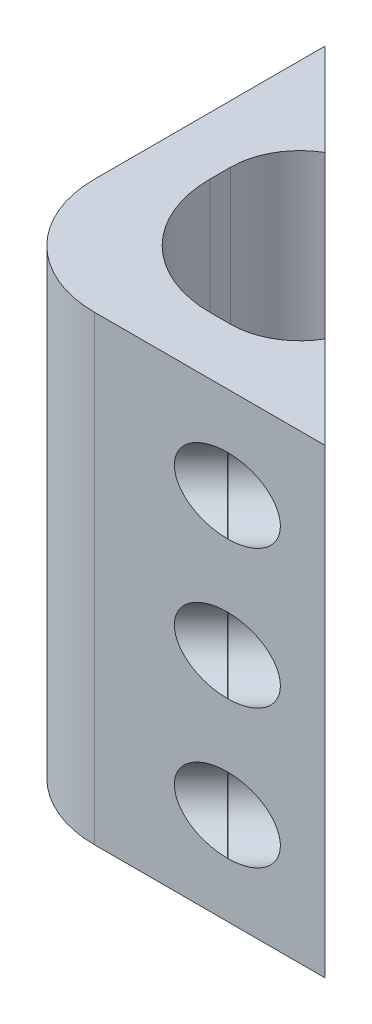
from build123d import *

# Parameters (mm, degrees)
SKETCH1_W                                    = 30
SKETCH1_H                                    = 30
SKETCH1_R                                    = 10
BOSS_EXTRUDE1_DEPTH                          = 40
CUT_EXTRUDE1_DEPTH                           = 59.309518948
CUT_EXTRUDE2_DEPTH                           = 59.309518948
BOSS_EXTRUDE2_DEPTH                          = 40
FILLET1_R                                    = 6
M3_CLEARANCE_HOLE1_D                         = 3.2
M3_CLEARANCE_HOLE1_CSINK_D                   = 3.25
M3_CLEARANCE_HOLE1_CSINK_ANGLE               = 90
CBORE_FOR_M3_HEX_SOCKET_HEAD_CAP_SCR_2_COUNT = 2
CBORE_FOR_M3_HEX_SOCKET_HEAD_CAP_SCR_2_PITCH = 12
CBORE_FOR_M3_HEX_SOCKET_HEAD_CAP_SCR_3_COUNT = 2
CBORE_FOR_M3_HEX_SOCKET_HEAD_CAP_SCR_3_PITCH = 24
CBORE_FOR_M3_HEX_SOCKET_HEAD_CAP_SCR_4_COUNT = 2
CBORE_FOR_M3_HEX_SOCKET_HEAD_CAP_SCR_4_PITCH = 30.426406871
CBORE_FOR_M3_HEX_SOCKET_HEAD_CAP_SCR_5_COUNT = 2
CBORE_FOR_M3_HEX_SOCKET_HEAD_CAP_SCR_5_PITCH = 32.707281072
CBORE_FOR_M3_HEX_SOCKET_HEAD_CAP_SCR_6_COUNT = 2
CBORE_FOR_M3_HEX_SOCKET_HEAD_CAP_SCR_6_PITCH = 38.752628751
SKETCH10_R                                   = 3.25
CUT_EXTRUDE3_DEPTH                           = 47.55178469
FILLET2_R                                    = 10


with BuildPart() as part:
    # Sketch1 → Boss-Extrude1 (new body)
    with BuildSketch(Plane(origin=(0, 0, 0), x_dir=(1, 0, 0), z_dir=(0, 1, 0))):
        with Locations((15, 15)):
            Rectangle(SKETCH1_W, SKETCH1_H)
        with Locations(Location((15, 15, 0), (0, 0, 270))):
            Circle(SKETCH1_R, mode=Mode.SUBTRACT)
    extrude(amount=BOSS_EXTRUDE1_DEPTH)

    # Sketch2 → Cut-Extrude1 (cut, through all)
    with BuildSketch(Plane(origin=(0, 40, 0), x_dir=(1, 0, 0), z_dir=(0, 1, 0))):
        with BuildLine():
            Line((5, 15), (5, 30))
            Line((5, 30), (30, 30))
            Line((30, 30), (30, 5))
            Line((30, 5), (15, 5))
            ThreePointArc((15, 5), (7.928932188, 7.928932188), (5, 15))
        make_face()
    extrude(amount=-CUT_EXTRUDE1_DEPTH, mode=Mode.SUBTRACT)

    # Sketch3 → Cut-Extrude2 (cut, through all)
    with BuildSketch(Plane(origin=(0, 40, 0), x_dir=(1, 0, 0), z_dir=(0, 1, 0))):
        Polygon((0, 30), (5, 25), (5, 30), align=None)
        Polygon((30, 0), (25, 5), (30, 5), align=None)
    extrude(amount=-CUT_EXTRUDE2_DEPTH, mode=Mode.SUBTRACT)

    # Sketch7 → Boss-Extrude2 (add)
    with BuildSketch(Plane(origin=(0, 40, 0), x_dir=(1, 0, 0), z_dir=(0, 1, 0))):
        Polygon((5, 25), (8, 22), (5, 22), align=None)
        Polygon((25, 5), (22, 8), (22, 5), align=None)
    extrude(amount=-BOSS_EXTRUDE2_DEPTH)

    # Fillet1
    # the kernel refuses this fillet: 6 mm, written as the material it adds along each edge
    with BuildSketch(Plane(origin=(5, 40, -22), x_dir=(1, 0, 0), z_dir=(0, -1, 0))) as fillet1_piece_1_section:
        with BuildLine():
            CenterArc((6, 5.196152423), FILLET1_R, 180, 60)
            Line((0, 5.196152423), (-0.12, 5.196152423))
            Line((-0.12, 5.196152423), (-0.12, 0))
            Line((-0.12, 0), (0, -0.12))
            ThreePointArc((0, -0.12), (1.5, -0.12), (2.94, -0.103923048))
            Line((2.94, -0.103923048), (3, 0))
        make_face()
    fillet1_piece_1 = extrude(amount=40, mode=Mode.PRIVATE)
    fillet1_piece_1 = split(fillet1_piece_1, bisect_by=Plane(origin=(7.537314478, 20, -22.462685522), z_dir=(-0.7071067811865479, 0, 0.7071067811865474)), keep=Keep.TOP, mode=Mode.PRIVATE)
    add(fillet1_piece_1)
    with BuildSketch(Plane(origin=(22, 40, -5), x_dir=(-1, 0, 0), z_dir=(0, -1, 0))) as fillet1_piece_2_section:
        with BuildLine():
            CenterArc((5.196152423, 6), FILLET1_R, 210, 60)
            Line((0, 3), (-0.103923048, 2.94))
            ThreePointArc((-0.103923048, 2.94), (-0.12, 1.5), (-0.12, 0))
            Line((-0.12, 0), (0, -0.12))
            Line((0, -0.12), (5.196152423, -0.12))
            Line((5.196152423, -0.12), (5.196152423, 0))
        make_face()
    fillet1_piece_2 = extrude(amount=40, mode=Mode.PRIVATE)
    fillet1_piece_2 = split(fillet1_piece_2, bisect_by=Plane(origin=(22.462685522, 20, -7.537314478), z_dir=(-0.7071067811865436, 0, 0.7071067811865516)), keep=Keep.TOP, mode=Mode.PRIVATE)
    add(fillet1_piece_2)

    # M3 Clearance Hole1 (through all)
    with Locations(Plane(origin=(15, 0, -15), x_dir=(-0.7071067811865475, 0, -0.7071067811865476), z_dir=(0.7071067811865476, 0, -0.7071067811865475))):
        with Locations((-15.213203436, 32), (15.213203436, 32), (15.213203436, 20), (15.213203436, 8), (-15.213203436, 8), (-15.213203436, 20)):
            CounterSinkHole(M3_CLEARANCE_HOLE1_D / 2, M3_CLEARANCE_HOLE1_CSINK_D / 2, counter_sink_angle=M3_CLEARANCE_HOLE1_CSINK_ANGLE)

    # Sketch9 → CBORE for M3 Hex Socket Head Cap Screw1 (revolve, cut)
    with BuildSketch(Plane(origin=(21.514718626, 32, 0), x_dir=(0.7071067811865515, 0, 0.7071067811865436), z_dir=(0, 1, 0))):
        Polygon((0, 0), (0, 27.213203436), (1.7, 27.213203436), (1.7, 3.4), (3.25, 3.4), (3.25, 0.025), (3.275, 0), align=None)
    cbore_for_m3_hex_socket_head_cap_screw1 = revolve(axis=Axis((17.024590565, 32, 4.490128061), (0.7071067811865436, 0, -0.7071067811865515)), mode=Mode.SUBTRACT)

    # CBORE for M3 Hex Socket Head Cap Scr 2: CBORE for M3 Hex Socket Head Cap Screw1 ×2
    with Locations(*[(0, -i * CBORE_FOR_M3_HEX_SOCKET_HEAD_CAP_SCR_2_PITCH, 0) for i in range(1, CBORE_FOR_M3_HEX_SOCKET_HEAD_CAP_SCR_2_COUNT)]):
        add(cbore_for_m3_hex_socket_head_cap_screw1, mode=Mode.SUBTRACT)

    # CBORE for M3 Hex Socket Head Cap Scr 3: CBORE for M3 Hex Socket Head Cap Screw1 ×2
    with Locations(*[(0, -i * CBORE_FOR_M3_HEX_SOCKET_HEAD_CAP_SCR_3_PITCH, 0) for i in range(1, CBORE_FOR_M3_HEX_SOCKET_HEAD_CAP_SCR_3_COUNT)]):
        add(cbore_for_m3_hex_socket_head_cap_screw1, mode=Mode.SUBTRACT)

    # CBORE for M3 Hex Socket Head Cap Scr 4: CBORE for M3 Hex Socket Head Cap Screw1 ×2
    with Locations(*[Vector(-0.7071067811865515, 0, -0.7071067811865437) * (i * CBORE_FOR_M3_HEX_SOCKET_HEAD_CAP_SCR_4_PITCH) for i in range(1, CBORE_FOR_M3_HEX_SOCKET_HEAD_CAP_SCR_4_COUNT)]):
        add(cbore_for_m3_hex_socket_head_cap_screw1, mode=Mode.SUBTRACT)

    # CBORE for M3 Hex Socket Head Cap Scr 5: CBORE for M3 Hex Socket Head Cap Screw1 ×2
    with Locations(*[Vector(-0.6577959989617107, -0.3668907841578198, -0.6577959989617034) * (i * CBORE_FOR_M3_HEX_SOCKET_HEAD_CAP_SCR_5_PITCH) for i in range(1, CBORE_FOR_M3_HEX_SOCKET_HEAD_CAP_SCR_5_COUNT)]):
        add(cbore_for_m3_hex_socket_head_cap_screw1, mode=Mode.SUBTRACT)

    # CBORE for M3 Hex Socket Head Cap Scr 6: CBORE for M3 Hex Socket Head Cap Screw1 ×2
    with Locations(*[Vector(-0.5551808824158828, -0.6193128253151639, -0.5551808824158766) * (i * CBORE_FOR_M3_HEX_SOCKET_HEAD_CAP_SCR_6_PITCH) for i in range(1, CBORE_FOR_M3_HEX_SOCKET_HEAD_CAP_SCR_6_COUNT)]):
        add(cbore_for_m3_hex_socket_head_cap_screw1, mode=Mode.SUBTRACT)

    # Sketch10 → Cut-Extrude3 (cut, through all)
    with BuildSketch(Plane(origin=(13.161522369, 0, -13.161522369), x_dir=(0.7071067811865515, 0, 0.7071067811865436), z_dir=(-0.7071067811865436, 0, 0.7071067811865515))):
        with Locations((-15.213203436, 8)):
            Circle(SKETCH10_R)
        with Locations((-15.213203436, 20)):
            Circle(SKETCH10_R)
        with Locations((-15.213203436, 32)):
            Circle(SKETCH10_R)
        with Locations((15.213203436, 32)):
            Circle(SKETCH10_R)
        with Locations((15.213203436, 20)):
            Circle(SKETCH10_R)
        with Locations((15.213203436, 8)):
            Circle(SKETCH10_R)
    extrude(amount=CUT_EXTRUDE3_DEPTH, mode=Mode.SUBTRACT)

    # Fillet2
    fillet2_edges = [part.edges().sort_by_distance(p)[0] for p in [
        (0, 20, 0),
    ]]
    fillet(fillet2_edges, radius=FILLET2_R)


solid = part.part
